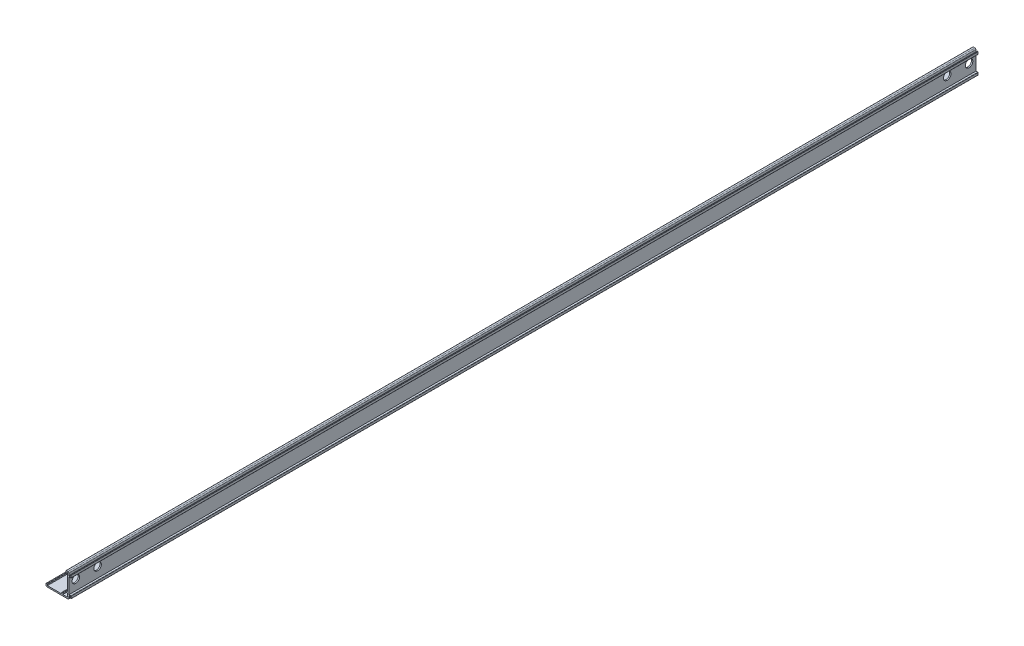
from build123d import *

# Parameters (mm, degrees)
MAIN_W                 = 46.736
MAIN_H                 = 1689.1
EXTRUDE_MAIN_DEPTH     = 44.45
MAIN_CUT_W             = 37.338
MAIN_CUT_H             = 39.37
CUT_MAIN_DEPTH         = 1690.846346839
BOTTOM_LEFT_W          = 26.67
BOTTOM_LEFT_H          = 2.667
CUT_BOTTOM_LEFT_DEPTH  = 1690.846346839
BOTTOM_RIGHT_W         = 6.096
BOTTOM_RIGHT_H         = 2.667
CUT_BOTTOM_RIGHT_DEPTH = 1690.846346839
LEFT_BOTTOM_W          = 3.048
LEFT_BOTTOM_H          = 6.858
CUT_LEFT_BOTTOM_DEPTH  = 1690.846346839
LEFT_MIDDLE_W          = 3.048
LEFT_MIDDLE_H          = 30.48
CUT_LEFT_MID_DEPTH     = 1690.846346839
RIGHT_MIDDLE_W         = 7.874
RIGHT_MIDDLE_H         = 28.702
CUT_RIGHT_MID_DEPTH    = 1690.846346839
HOOK_CUT_DEPTH         = 1690.846346839
FILLET3_R              = 1.905
FILLET4_R              = 0.508
SCREW_HOLES_AT_2_COUNT = 2
SCREW_HOLES_AT_2_PITCH = 1623.06
SCREW_HOLES_AT_3_COUNT = 2
SCREW_HOLES_AT_3_PITCH = 1582.42
SCREW_HOLES_AT_4_COUNT = 2
SCREW_HOLES_AT_4_PITCH = 40.64


with BuildPart() as part:
    # Main → Extrude-Main (new body)
    with BuildSketch(Plane(origin=(0, 0, 0), x_dir=(1, 0, 0), z_dir=(0, 1, 0))):
        Rectangle(MAIN_W, MAIN_H)
    extrude(amount=EXTRUDE_MAIN_DEPTH)

    # Main Cut → Cut-Main (cut, through all)
    with BuildSketch(Plane.XY.offset(844.55)):
        with Locations((-4.699, 24.765)):
            Rectangle(MAIN_CUT_W, MAIN_CUT_H)
    extrude(amount=-CUT_MAIN_DEPTH, mode=Mode.SUBTRACT)

    # Bottom Left → Cut-Bottom Left (cut, through all)
    with BuildSketch(Plane.XY.offset(844.55)):
        with Locations((-7.493, 3.7465)):
            Rectangle(BOTTOM_LEFT_W, BOTTOM_LEFT_H)
    extrude(amount=-CUT_BOTTOM_LEFT_DEPTH, mode=Mode.SUBTRACT)

    # Bottom Right → Cut-Bottom Right (cut, through all)
    with BuildSketch(Plane.XY.offset(844.55)):
        with Locations((10.922, 3.7465)):
            Rectangle(BOTTOM_RIGHT_W, BOTTOM_RIGHT_H)
    extrude(amount=-CUT_BOTTOM_RIGHT_DEPTH, mode=Mode.SUBTRACT)

    # Left Bottom → Cut-Left Bottom (cut, through all)
    with BuildSketch(Plane.XY.offset(844.55)):
        with Locations((15.494, 5.842)):
            Rectangle(LEFT_BOTTOM_W, LEFT_BOTTOM_H)
    extrude(amount=-CUT_LEFT_BOTTOM_DEPTH, mode=Mode.SUBTRACT)

    # Left Middle → Cut-Left Mid (cut, through all)
    with BuildSketch(Plane.XY.offset(844.55)):
        with Locations((15.494, 26.730206209)):
            Rectangle(LEFT_MIDDLE_W, LEFT_MIDDLE_H)
    extrude(amount=-CUT_LEFT_MID_DEPTH, mode=Mode.SUBTRACT)

    # Right Middle → Cut-Right Mid (cut, through all)
    with BuildSketch(Plane.XY.offset(844.55)):
        with Locations((23.368, 22.225)):
            Rectangle(RIGHT_MIDDLE_W, RIGHT_MIDDLE_H)
    extrude(amount=-CUT_RIGHT_MID_DEPTH, mode=Mode.SUBTRACT)

    # Hooks → Hook Cut (cut, through all)
    with BuildSketch(Plane.XY.offset(844.55)):
        Polygon((19.431, 44.45), (19.431, 38.1635), (21.7805, 38.1635), (21.7805, 41.402), (23.368, 41.402), (23.368, 44.45), align=None)
        Polygon((23.368, 3.048), (23.368, 0), (19.431, 0), (19.431, 6.2865), (21.7805, 6.2865), (21.7805, 3.048), align=None)
    extrude(amount=-HOOK_CUT_DEPTH, mode=Mode.SUBTRACT)

    # Fillet3
    fillet3_edges = [part.edges().sort_by_distance(p)[0] for p in [
        (19.431, 0, 0),
        (19.431, 44.45, 0),
        (-23.368, 0, 0),
    ]]
    fillet(fillet3_edges, radius=FILLET3_R)

    # Fillet4
    fillet4_edges = [part.edges().sort_by_distance(p)[0] for p in [
        (-23.368, 5.08, 0),
        (-20.828, 5.08, 0),
        (13.97, 41.970206209, 0),
        (13.97, 44.45, 0),
        (13.97, 9.271, 0),
        (13.97, 11.490206209, 0),
        (5.842, 5.08, 0),
        (7.874, 5.08, 0),
        (23.368, 41.402, 0),
        (23.368, 36.576, 0),
        (23.368, 7.874, 0),
        (23.368, 3.048, 0),
        (21.7805, 3.048, 0),
        (21.7805, 41.402, 0),
    ]]
    fillet(fillet4_edges, radius=FILLET4_R)

    # Hole → Screw Holes (revolve, cut)
    with BuildSketch(Plane(origin=(17.018, 26.730206209, -791.21), x_dir=(0, 0, 1), z_dir=(0, 1, 0))):
        Polygon((0, 0), (0, 6.35), (3.5, 6.35), (3.5, 4.7), (6.975, 4.7), (6.975, 0.025), (7, 0), align=None)
    screw_holes = revolve(axis=Axis((10.668, 26.730206209, -791.21), (1, 0, 0)), mode=Mode.SUBTRACT)

    # Screw Holes at 2: Screw Holes ×2
    with Locations(*[(0, 0, i * SCREW_HOLES_AT_2_PITCH) for i in range(1, SCREW_HOLES_AT_2_COUNT)]):
        add(screw_holes, mode=Mode.SUBTRACT)

    # Screw Holes at 3: Screw Holes ×2
    with Locations(*[(0, 0, i * SCREW_HOLES_AT_3_PITCH) for i in range(1, SCREW_HOLES_AT_3_COUNT)]):
        add(screw_holes, mode=Mode.SUBTRACT)

    # Screw Holes at 4: Screw Holes ×2
    with Locations(*[(0, 0, -i * SCREW_HOLES_AT_4_PITCH) for i in range(1, SCREW_HOLES_AT_4_COUNT)]):
        add(screw_holes, mode=Mode.SUBTRACT)


solid = part.part
